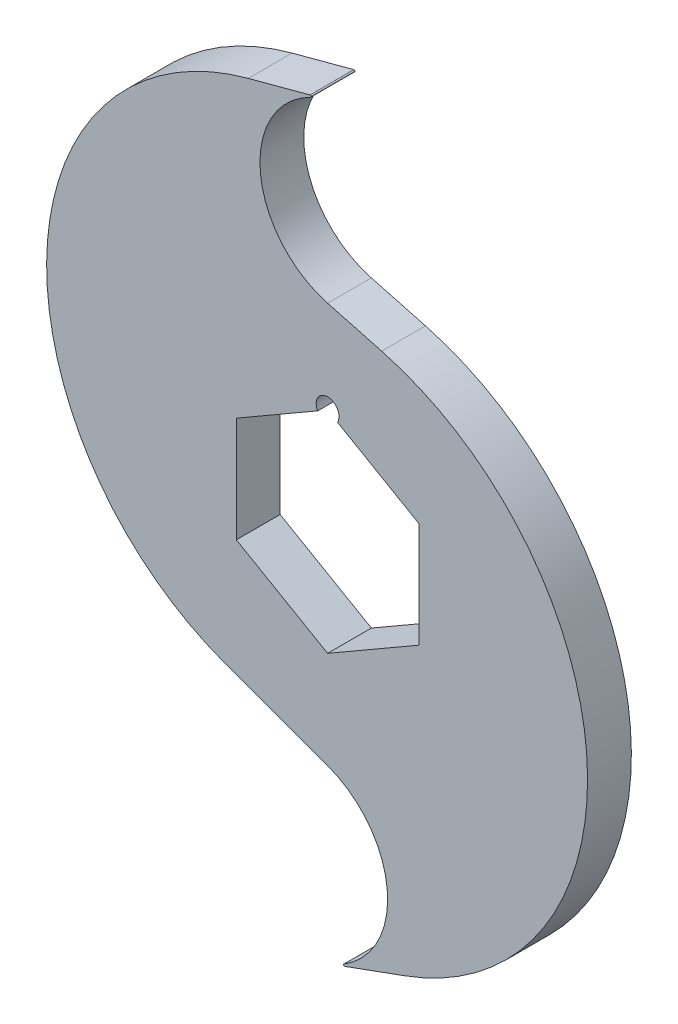
from build123d import *

# Parameters (mm, degrees)
BOSS_EXTRUDE1_DEPTH = 3.048
FILLET1_R           = 0.127


with BuildPart() as part:
    # Sketch1 → Boss-Extrude1 (new, symmetric)
    with BuildSketch(Plane.XY):
        with BuildLine():
            ThreePointArc((0, 27.535484012), (-9.412998127, 39.802742006), (0, 52.07))
            Line((0, 52.07), (-11.040532194, 49.111698314))
            ThreePointArc((-11.040532194, 49.111698314), (-39.066320922, 14.192289272), (-14.190605813, -23.03684931))
            Line((-14.190605813, -23.03684931), (0, -28.201807432))
            ThreePointArc((0, -28.201807432), (8.35634418, -40.135903716), (0, -52.07))
            Line((0, -52.07), (10.740686656, -48.160709762))
            ThreePointArc((10.740686656, -48.160709762), (36.144496882, -10.141220984), (7.52373904, 25.519504212))
            Line((7.52373904, 25.519504212), (0, 27.535484012))
        make_face()
        with BuildLine():
            Line((-12.7, 7.332348419), (-1.374815329, 13.870946837))
            ThreePointArc((-1.374815329, 13.870946837), (-0.410875234, 16.198104087), (1.5875, 14.664696837))
            ThreePointArc((1.5875, 14.664696837), (1.533407249, 14.253821603), (1.374815329, 13.870946837))
            Line((1.374815329, 13.870946837), (12.7, 7.332348419))
            Line((12.7, 7.332348419), (12.7, -7.332348419))
            Line((12.7, -7.332348419), (0, -14.664696837))
            Line((0, -14.664696837), (-12.7, -7.332348419))
            Line((-12.7, -7.332348419), (-12.7, 7.332348419))
        make_face(mode=Mode.SUBTRACT)
    extrude(amount=BOSS_EXTRUDE1_DEPTH, both=True)

    # Fillet1
    fillet1_edges = [part.edges().sort_by_distance(p)[0] for p in [
        (0, 52.07, 0),
        (0, -52.07, 0),
    ]]
    fillet(fillet1_edges, radius=FILLET1_R)


solid = part.part
